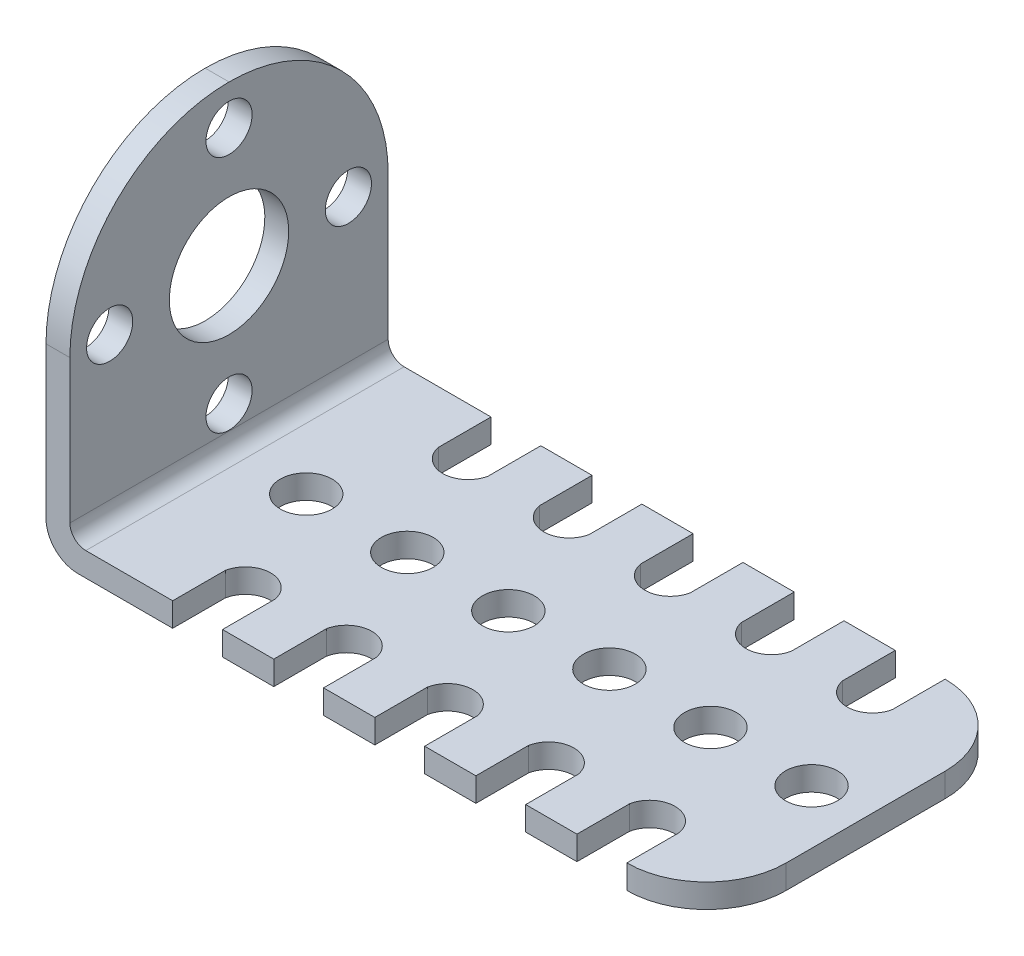
from build123d import *

# Parameters (mm, degrees)
BOSS_EXTRUDE1_DEPTH   = 20
FILLET1_R             = 2
FILLET2_R             = 1
CUT_EXTRUDE1_DEPTH    = 51.222007128
F_4_CLEARANCE_HOLE1_D = 3.2639
FILLET3_R             = 5
FILLET4_R             = 10
SKETCH7_R             = 3.75
SKETCH7_R_2           = 1.45
CUT_EXTRUDE2_DEPTH    = 51.83797793


with BuildPart() as part:
    # Sketch1 → Boss-Extrude1 (new body)
    with BuildSketch(Plane.XY):
        Polygon((0, 0), (41.5, 0), (41.5, 1.5), (1.5, 1.5), (1.5, 21.5), (0, 21.5), align=None)
    extrude(amount=BOSS_EXTRUDE1_DEPTH)

    # Fillet1
    fillet1_edges = [part.edges().sort_by_distance(p)[0] for p in [
        (0, 0, 10),
    ]]
    fillet(fillet1_edges, radius=FILLET1_R)

    # Fillet2
    fillet2_edges = [part.edges().sort_by_distance(p)[0] for p in [
        (1.5, 1.5, 10),
    ]]
    fillet(fillet2_edges, radius=FILLET2_R)

    # Sketch3 → Cut-Extrude1 (cut, through all)
    with BuildSketch(Plane(origin=(0, 1.5, 0), x_dir=(1, 0, 0), z_dir=(0, 1, 0))):
        with BuildLine():
            Line((7.96, 0), (11.09, 0))
            Line((11.09, 0), (11.09, -3.307162367))
            ThreePointArc((11.09, -3.307162367), (9.525, -4.594858526), (7.96, -3.307162367))
            Line((7.96, -3.307162367), (7.96, 0))
        make_face()
        with BuildLine():
            Line((14.31, 0), (17.44, 0))
            Line((17.44, 0), (17.44, -3.307162367))
            ThreePointArc((17.44, -3.307162367), (15.875, -4.594858526), (14.31, -3.307162367))
            Line((14.31, -3.307162367), (14.31, 0))
        make_face()
        with BuildLine():
            Line((20.66, 0), (23.79, 0))
            Line((23.79, 0), (23.79, -3.307162367))
            ThreePointArc((23.79, -3.307162367), (22.225, -4.594858526), (20.66, -3.307162367))
            Line((20.66, -3.307162367), (20.66, 0))
        make_face()
        with BuildLine():
            Line((27.01, 0), (30.14, 0))
            Line((30.14, 0), (30.14, -3.307162367))
            ThreePointArc((30.14, -3.307162367), (28.575, -4.594858526), (27.01, -3.307162367))
            Line((27.01, -3.307162367), (27.01, 0))
        make_face()
        with BuildLine():
            Line((33.36, 0), (36.49, 0))
            Line((36.49, 0), (36.49, -3.307162367))
            ThreePointArc((36.49, -3.307162367), (34.925, -4.594858526), (33.36, -3.307162367))
            Line((33.36, -3.307162367), (33.36, 0))
        make_face()
        with BuildLine():
            Line((36.49, -20), (36.49, -16.692837633))
            ThreePointArc((36.49, -16.692837633), (34.925, -15.405141474), (33.36, -16.692837633))
            Line((33.36, -16.692837633), (33.36, -20))
            Line((33.36, -20), (36.49, -20))
        make_face()
        with BuildLine():
            Line((30.14, -20), (30.14, -16.692837633))
            ThreePointArc((30.14, -16.692837633), (28.575, -15.405141474), (27.01, -16.692837633))
            Line((27.01, -16.692837633), (27.01, -20))
            Line((27.01, -20), (30.14, -20))
        make_face()
        with BuildLine():
            Line((23.79, -20), (23.79, -16.692837633))
            ThreePointArc((23.79, -16.692837633), (22.225, -15.405141474), (20.66, -16.692837633))
            Line((20.66, -16.692837633), (20.66, -20))
            Line((20.66, -20), (23.79, -20))
        make_face()
        with BuildLine():
            Line((17.44, -20), (17.44, -16.692837633))
            ThreePointArc((17.44, -16.692837633), (15.875, -15.405141474), (14.31, -16.692837633))
            Line((14.31, -16.692837633), (14.31, -20))
            Line((14.31, -20), (17.44, -20))
        make_face()
        with BuildLine():
            Line((11.09, -20), (11.09, -16.692837633))
            ThreePointArc((11.09, -16.692837633), (9.525, -15.405141474), (7.96, -16.692837633))
            Line((7.96, -16.692837633), (7.96, -20))
            Line((7.96, -20), (11.09, -20))
        make_face()
    extrude(amount=-CUT_EXTRUDE1_DEPTH, mode=Mode.SUBTRACT)

    # #4 Clearance Hole1 (through all)
    with Locations(Plane(origin=(0, 1.5, 0), x_dir=(1, 0, 0), z_dir=(0, 1, 0))):
        with Locations((6.35, -10), (12.7, -10), (25.4, -10), (31.75, -10), (38.1, -10), (19.05, -10)):
            Hole(F_4_CLEARANCE_HOLE1_D / 2)

    # Fillet3
    fillet3_edges = [part.edges().sort_by_distance(p)[0] for p in [
        (41.5, 0.75, 20),
        (41.5, 0.75, 0),
    ]]
    fillet(fillet3_edges, radius=FILLET3_R)

    # Fillet4
    fillet4_edges = [part.edges().sort_by_distance(p)[0] for p in [
        (0.75, 21.5, 0),
        (0.75, 21.5, 20),
    ]]
    fillet(fillet4_edges, radius=FILLET4_R - 0.0001)  # a hair under: the kernel refuses the full size

    # Sketch7 → Cut-Extrude2 (cut, through all)
    with BuildSketch(Plane.ZY):
        with Locations(Location((10, 11.5, 0), (0, 0, 270))):
            Circle(SKETCH7_R)
        with Locations(Location((10, 19, 0), (0, 0, 270))):
            Circle(SKETCH7_R_2)
        with Locations(Location((17.5, 11.5, 0), (0, 0, 270))):
            Circle(SKETCH7_R_2)
        with Locations(Location((10, 4, 0), (0, 0, 270))):
            Circle(SKETCH7_R_2)
        with Locations(Location((2.5, 11.5, 0), (0, 0, 270))):
            Circle(SKETCH7_R_2)
    extrude(amount=-CUT_EXTRUDE2_DEPTH, mode=Mode.SUBTRACT)


solid = part.part
